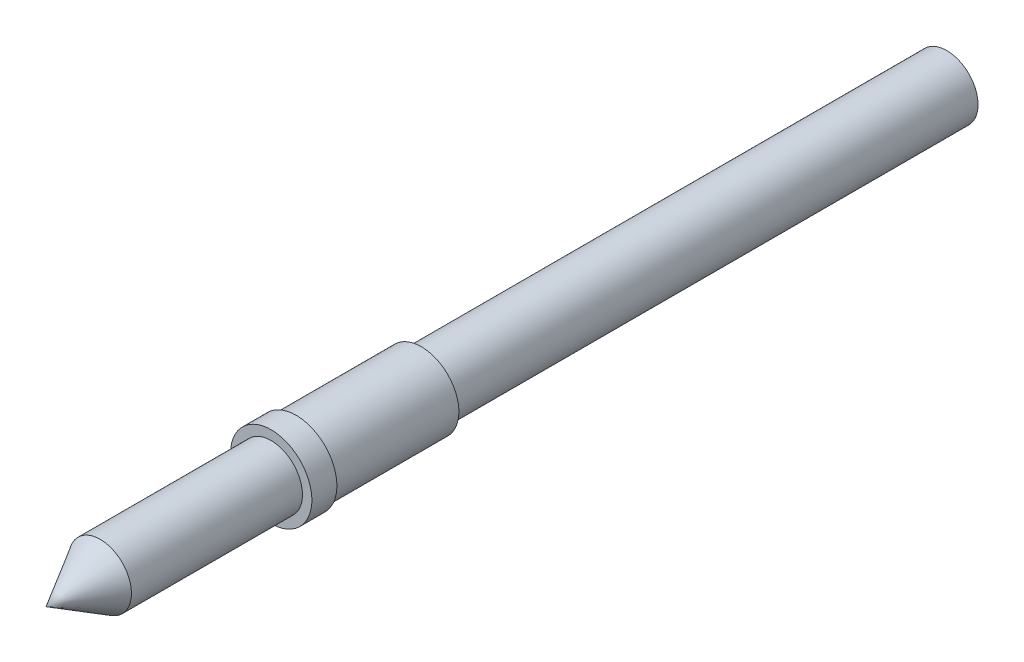
from build123d import *


with BuildPart() as part:
    # Sketch3 → Revolve2 (revolve)
    with BuildSketch(Plane(origin=(0, 0, 0), x_dir=(0, 0, -1), z_dir=(1, 0, 0))):
        Polygon((-214.851846715, 7.9375), (-228.6, 0), (0, 0), (0, 7.9375), (-133.35, 7.9375), (-133.35, 9.525), (-165.1, 9.525), (-165.1, 10.31875), (-171.45, 10.31875), (-171.45, 7.9375), align=None)
    revolve(axis=Axis((0, 0, 0), (0, 0, 1)))


solid = part.part
